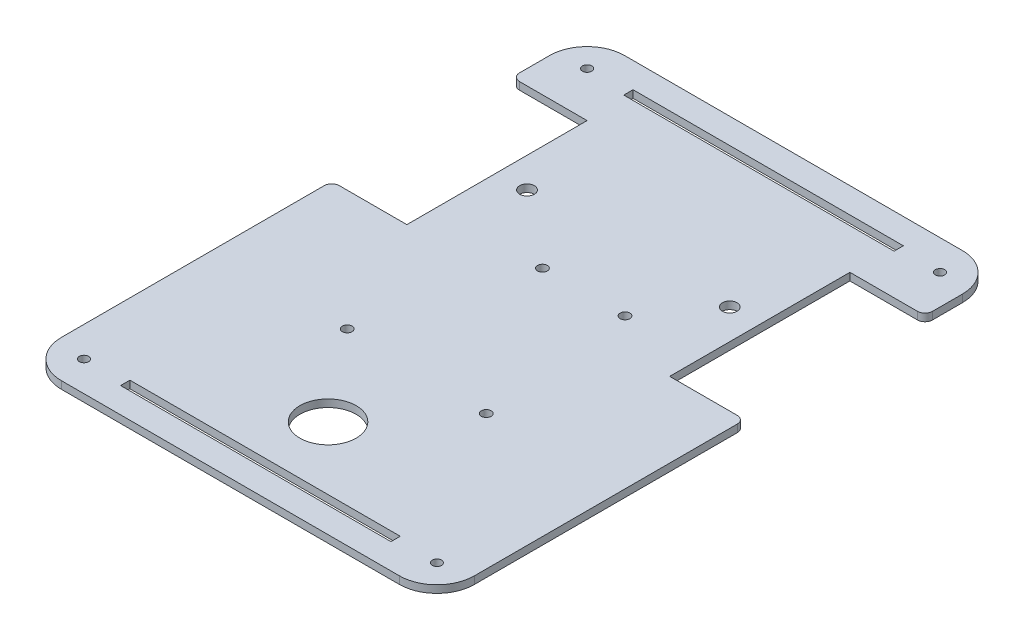
from build123d import *

# Parameters (mm, degrees)
SKETCH2_W                    = 139.7
SKETCH2_H                    = 190.5
BASE_PLATE_DEPTH             = 2.54
SKETCH5_W                    = 25.4
SKETCH5_H                    = 60.96
STEERING_WHEELS_HOLES_DEPTH  = 6.35
FILLET1_R                    = 12.7
FILLET2_R                    = 2.54
SKETCH18_R                   = 1.651
HOLES_FOR_ARDUINO_UNO_DEPTH  = 119.144134852
SKETCH20_R                   = 9.525
CUTOUT_FOR_MOTOR_WIRES_DEPTH = 119.144134852
HOLES_FOR_STEERING_D         = 5
SKETCH24_R                   = 1.57
CUT_EXTRUDE1_DEPTH           = 2.54
SKETCH25_R                   = 1.57
CUT_EXTRUDE3_DEPTH           = 2.54
SKETCH27_W                   = 91.44
SKETCH27_H                   = 3.14
CUT_EXTRUDE4_DEPTH           = 2.54


with BuildPart() as part:
    # Sketch2 → Base Plate (new body)
    with BuildSketch(Plane(origin=(0, 0, 0), x_dir=(1, 0, 0), z_dir=(0, 1, 0))):
        Rectangle(SKETCH2_W, SKETCH2_H)
    extrude(amount=BASE_PLATE_DEPTH)

    # Sketch5 → Steering Wheels Holes (cut)
    with BuildSketch(Plane(origin=(0, 2.54, 0), x_dir=(1, 0, 0), z_dir=(0, 1, 0))):
        with Locations((-57.15, 39.37)):
            Rectangle(SKETCH5_W, SKETCH5_H)
        with Locations((57.15, 39.37)):
            Rectangle(SKETCH5_W, SKETCH5_H)
    extrude(amount=-STEERING_WHEELS_HOLES_DEPTH, mode=Mode.SUBTRACT)

    # Fillet1
    fillet1_edges = [part.edges().sort_by_distance(p)[0] for p in [
        (69.85, 1.27, -95.25),
        (-69.85, 1.27, -95.25),
        (69.85, 1.27, 95.25),
        (-69.85, 1.27, 95.25),
    ]]
    fillet(fillet1_edges, radius=FILLET1_R)

    # Fillet2
    fillet2_edges = [part.edges().sort_by_distance(p)[0] for p in [
        (69.85, 1.27, -69.85),
        (69.85, 1.27, -8.89),
        (-69.85, 1.27, -8.89),
        (-69.85, 1.27, -69.85),
    ]]
    fillet(fillet2_edges, radius=FILLET2_R)

    # Sketch18 → Holes for Arduino UNO (cut, through all)
    with BuildSketch(Plane(origin=(0, 2.54, 0), x_dir=(1, 0, 0), z_dir=(0, 1, 0))):
        with Locations((-8.763, 19.05)):
            Circle(SKETCH18_R)
        with Locations((19.177, 19.05)):
            Circle(SKETCH18_R)
        with Locations((-24.003, -31.75)):
            Circle(SKETCH18_R)
        with Locations((24.309664393, -33.02)):
            Circle(SKETCH18_R)
    extrude(amount=-HOLES_FOR_ARDUINO_UNO_DEPTH, mode=Mode.SUBTRACT)

    # Sketch20 → Cutout for motor wires (cut, through all)
    with BuildSketch(Plane(origin=(0, 2.54, 0), x_dir=(1, 0, 0), z_dir=(0, 1, 0))):
        with Locations((0, -62.23)):
            Circle(SKETCH20_R)
    extrude(amount=-CUTOUT_FOR_MOTOR_WIRES_DEPTH, mode=Mode.SUBTRACT)

    # holes for steering (through all)
    with Locations(Plane(origin=(0, 2.54, 0), x_dir=(1, 0, 0), z_dir=(0, 1, 0))):
        with Locations((-34.29, 39.37), (34.29, 39.37)):
            Hole(HOLES_FOR_STEERING_D / 2)

    # Sketch24 → Cut-Extrude1 (cut)
    with BuildSketch(Plane(origin=(0, 2.54, 0), x_dir=(1, 0, 0), z_dir=(0, 1, 0))):
        with Locations((-59.69, 85.09)):
            Circle(SKETCH24_R)
    cut_extrude1 = extrude(amount=-CUT_EXTRUDE1_DEPTH, mode=Mode.SUBTRACT)

    # Mirror1: Cut-Extrude1 across plane
    add(cut_extrude1.mirror(Plane(origin=(0, 0, 0), x_dir=(0, 0, 1), z_dir=(1, 0, 0))), mode=Mode.SUBTRACT)

    # Sketch25 → Cut-Extrude3 (cut)
    with BuildSketch(Plane(origin=(0, 2.54, 0), x_dir=(1, 0, 0), z_dir=(0, 1, 0))):
        with Locations((-59.69, -85.09)):
            Circle(SKETCH25_R)
        with Locations((59.69, -85.09)):
            Circle(SKETCH25_R)
    extrude(amount=-CUT_EXTRUDE3_DEPTH, mode=Mode.SUBTRACT)

    # Sketch27 → Cut-Extrude4 (cut)
    with BuildSketch(Plane(origin=(0, 2.54, 0), x_dir=(1, 0, 0), z_dir=(0, 1, 0))):
        with Locations((0, -85.09)):
            Rectangle(SKETCH27_W, SKETCH27_H)
        with Locations((0, 85.09)):
            Rectangle(SKETCH27_W, SKETCH27_H)
    extrude(amount=-CUT_EXTRUDE4_DEPTH, mode=Mode.SUBTRACT)


solid = part.part
